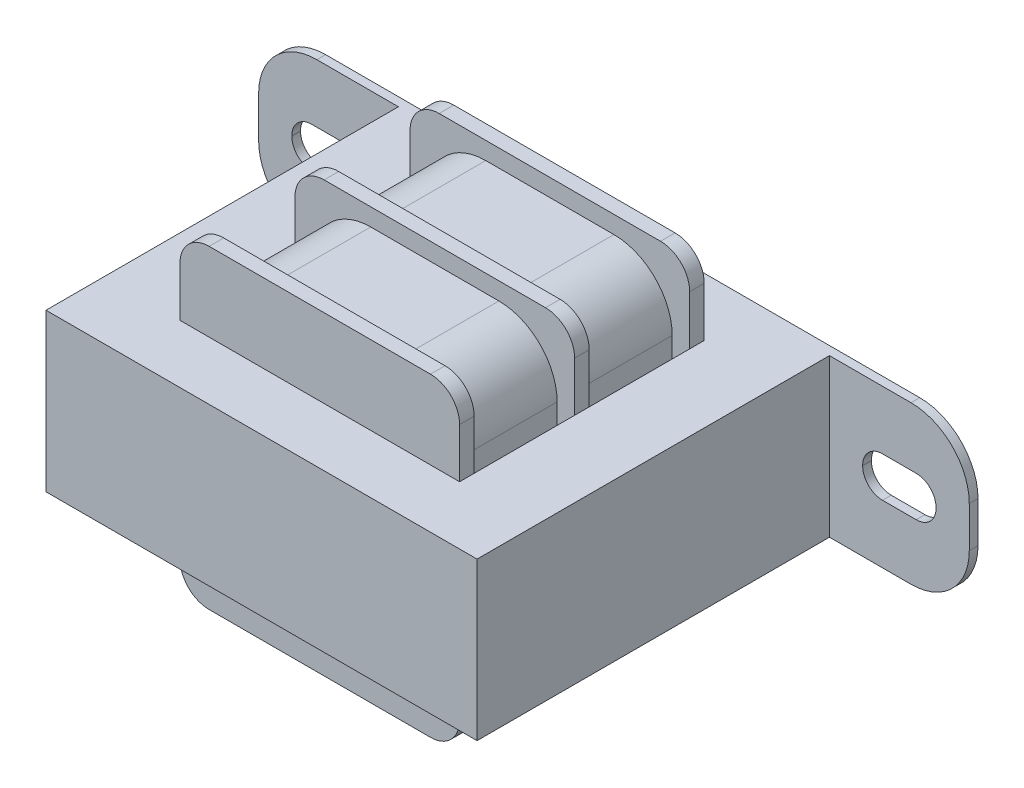
from build123d import *

# Parameters (mm, degrees)
SKETCH1_W           = 37
SKETCH1_H           = 13.5
BOSS_EXTRUDE1_DEPTH = 15.5
SKETCH2_W           = 24
SKETCH2_H           = 21
CUT_EXTRUDE1_DEPTH  = 31
SKETCH3_W           = 24
SKETCH3_H           = 27
BOSS_EXTRUDE2_DEPTH = 1.25
SKETCH4_W           = 24
SKETCH4_H           = 27
BOSS_EXTRUDE3_DEPTH = 1.25
SKETCH5_W           = 24
SKETCH5_H           = 27
BOSS_EXTRUDE4_DEPTH = 0.625
CUT_EXTRUDE2_DEPTH  = 30
CUT_EXTRUDE3_DEPTH  = 30
BOSS_EXTRUDE5_DEPTH = 10
SKETCH9_W           = 13.5
SKETCH9_H           = 12
BOSS_EXTRUDE6_DEPTH = 0.75
CUT_EXTRUDE6_START  = -0.75
CUT_EXTRUDE6_DEPTH  = 0.75
CUT_EXTRUDE7_DEPTH  = 0.75
SKETCH15_W          = 13.5
SKETCH15_H          = 12
BOSS_EXTRUDE7_DEPTH = 0.75
CUT_EXTRUDE8_START  = -0.75
CUT_EXTRUDE8_DEPTH  = 0.75
CUT_EXTRUDE9_DEPTH  = 0.75


# Read off the part's stored shape, not the designer's step: Cut-Extrude6, Cut-Extrude8
with BuildPart() as part:
    # Sketch1 → Boss-Extrude1 (new, symmetric)
    with BuildSketch(Plane.XY):
        Rectangle(SKETCH1_W, SKETCH1_H)
    extrude(amount=BOSS_EXTRUDE1_DEPTH, both=True)

    # Sketch2 → Cut-Extrude1 (cut)
    with BuildSketch(Plane(origin=(0, 6.75, 0), x_dir=(1, 0, 0), z_dir=(0, 1, 0))):
        Rectangle(SKETCH2_W, SKETCH2_H)
    extrude(amount=-CUT_EXTRUDE1_DEPTH, mode=Mode.SUBTRACT)

    # Sketch3 → Boss-Extrude2 (add)
    with BuildSketch(Plane.XY.offset(-10.5)):
        Rectangle(SKETCH3_W, SKETCH3_H)
    extrude(amount=BOSS_EXTRUDE2_DEPTH)

    # Sketch4 → Boss-Extrude3 (add)
    with BuildSketch(Plane(origin=(0, 0, 10.5), x_dir=(-1, 0, 0), z_dir=(0, 0, -1))):
        Rectangle(SKETCH4_W, SKETCH4_H)
    extrude(amount=BOSS_EXTRUDE3_DEPTH)

    # Sketch5 → Boss-Extrude4 (add, symmetric)
    with BuildSketch(Plane.XY):
        Rectangle(SKETCH5_W, SKETCH5_H)
    extrude(amount=BOSS_EXTRUDE4_DEPTH, both=True)

    # Sketch6 → Cut-Extrude2 (cut)
    with BuildSketch(Plane(origin=(0, 0, -10.5), x_dir=(-1, 0, 0), z_dir=(0, 0, -1))):
        with BuildLine():
            Line((-12, -13.5), (-12, -11))
            ThreePointArc((-12, -11), (-11.267766953, -12.767766953), (-9.5, -13.5))
            Line((-9.5, -13.5), (-12, -13.5))
        make_face()
        with BuildLine():
            Line((12, -13.5), (12, -11))
            ThreePointArc((12, -11), (11.267766953, -12.767766953), (9.5, -13.5))
            Line((9.5, -13.5), (12, -13.5))
        make_face()
    extrude(amount=-CUT_EXTRUDE2_DEPTH, mode=Mode.SUBTRACT)

    # Sketch7 → Cut-Extrude3 (cut)
    with BuildSketch(Plane(origin=(0, 0, -10.5), x_dir=(-1, 0, 0), z_dir=(0, 0, -1))):
        with BuildLine():
            Line((12, 13.5), (9.5, 13.5))
            ThreePointArc((9.5, 13.5), (11.267766953, 12.767766953), (12, 11))
            Line((12, 11), (12, 13.5))
        make_face()
        with BuildLine():
            Line((-12, 13.5), (-12, 11))
            ThreePointArc((-12, 11), (-11.267766953, 12.767766953), (-9.5, 13.5))
            Line((-9.5, 13.5), (-12, 13.5))
        make_face()
    extrude(amount=-CUT_EXTRUDE3_DEPTH, mode=Mode.SUBTRACT)

    # Sketch8 → Boss-Extrude5 (add, symmetric)
    with BuildSketch(Plane.XY):
        with BuildLine():
            Line((-5.5, 12), (5.5, 12))
            ThreePointArc((5.5, 12), (9.035533906, 10.535533906), (10.5, 7))
            Line((10.5, 7), (10.5, -7))
            ThreePointArc((10.5, -7), (9.035533906, -10.535533906), (5.5, -12))
            Line((5.5, -12), (-5.5, -12))
            ThreePointArc((-5.5, -12), (-9.035533906, -10.535533906), (-10.5, -7))
            Line((-10.5, -7), (-10.5, 7))
            ThreePointArc((-10.5, 7), (-9.035533906, 10.535533906), (-5.5, 12))
        make_face()
    extrude(amount=BOSS_EXTRUDE5_DEPTH, both=True)

    # Sketch9 → Boss-Extrude6 (add)
    with BuildSketch(Plane(origin=(0, 0, -15.5), x_dir=(0, -1, 0), z_dir=(0, 0, -1))):
        with Locations((0, 24.5)):
            Rectangle(SKETCH9_W, SKETCH9_H)
    extrude(amount=-BOSS_EXTRUDE6_DEPTH)

    # Cut-Extrude6 outline → Cut-Extrude6 (cut)
    with BuildSketch(Plane.XY.offset(-14.75).offset(CUT_EXTRUDE6_START)):
        with BuildLine():
            Line((-30.5, 6.75), (-30.5, 1.75))
            ThreePointArc((-30.5, 1.75), (-29.035533906, 5.285533906), (-25.5, 6.75))
            Line((-25.5, 6.75), (-30.5, 6.75))
        make_face()
        with BuildLine():
            ThreePointArc((-25.5, -6.75), (-29.035533906, -5.285533906), (-30.5, -1.75))
            Line((-30.5, -1.75), (-30.5, -6.75))
            Line((-30.5, -6.75), (-25.5, -6.75))
        make_face()
    extrude(amount=CUT_EXTRUDE6_DEPTH, mode=Mode.SUBTRACT)

    # Sketch14 → Cut-Extrude7 (cut)
    with BuildSketch(Plane.XY.offset(-14.75)):
        with BuildLine():
            Line((-25.95, 1.725), (-23.05, 1.725))
            ThreePointArc((-23.05, 1.725), (-21.847918472, 1.227081528), (-21.35, 0.025))
            Line((-21.35, 0.025), (-21.35, -0.025))
            ThreePointArc((-21.35, -0.025), (-21.847918472, -1.227081528), (-23.05, -1.725))
            Line((-23.05, -1.725), (-25.95, -1.725))
            ThreePointArc((-25.95, -1.725), (-27.152081528, -1.227081528), (-27.65, -0.025))
            Line((-27.65, -0.025), (-27.65, 0.025))
            ThreePointArc((-27.65, 0.025), (-27.152081528, 1.227081528), (-25.95, 1.725))
        make_face()
    extrude(amount=-CUT_EXTRUDE7_DEPTH, mode=Mode.SUBTRACT)

    # Sketch15 → Boss-Extrude7 (add)
    with BuildSketch(Plane.YX.offset(15.5)):
        with Locations((0, 24.5)):
            Rectangle(SKETCH15_W, SKETCH15_H)
    extrude(amount=-BOSS_EXTRUDE7_DEPTH)

    # Cut-Extrude8 outline → Cut-Extrude8 (cut)
    with BuildSketch(Plane.XY.offset(-14.75).offset(CUT_EXTRUDE8_START)):
        with BuildLine():
            Line((30.5, -6.75), (30.5, -1.75))
            ThreePointArc((30.5, -1.75), (29.035533906, -5.285533906), (25.5, -6.75))
            Line((25.5, -6.75), (30.5, -6.75))
        make_face()
        with BuildLine():
            ThreePointArc((25.5, 6.75), (29.035533906, 5.285533906), (30.5, 1.75))
            Line((30.5, 1.75), (30.5, 6.75))
            Line((30.5, 6.75), (25.5, 6.75))
        make_face()
    extrude(amount=CUT_EXTRUDE8_DEPTH, mode=Mode.SUBTRACT)

    # Sketch18 → Cut-Extrude9 (cut)
    with BuildSketch(Plane.XY.offset(-14.75)):
        with BuildLine():
            Line((23.05, 1.725), (25.95, 1.725))
            ThreePointArc((25.95, 1.725), (27.152081528, 1.227081528), (27.65, 0.025))
            Line((27.65, 0.025), (27.65, -0.025))
            ThreePointArc((27.65, -0.025), (27.152081528, -1.227081528), (25.95, -1.725))
            Line((25.95, -1.725), (23.05, -1.725))
            ThreePointArc((23.05, -1.725), (21.847918472, -1.227081528), (21.35, -0.025))
            Line((21.35, -0.025), (21.35, 0.025))
            ThreePointArc((21.35, 0.025), (21.847918472, 1.227081528), (23.05, 1.725))
        make_face()
    extrude(amount=-CUT_EXTRUDE9_DEPTH, mode=Mode.SUBTRACT)


solid = part.part
